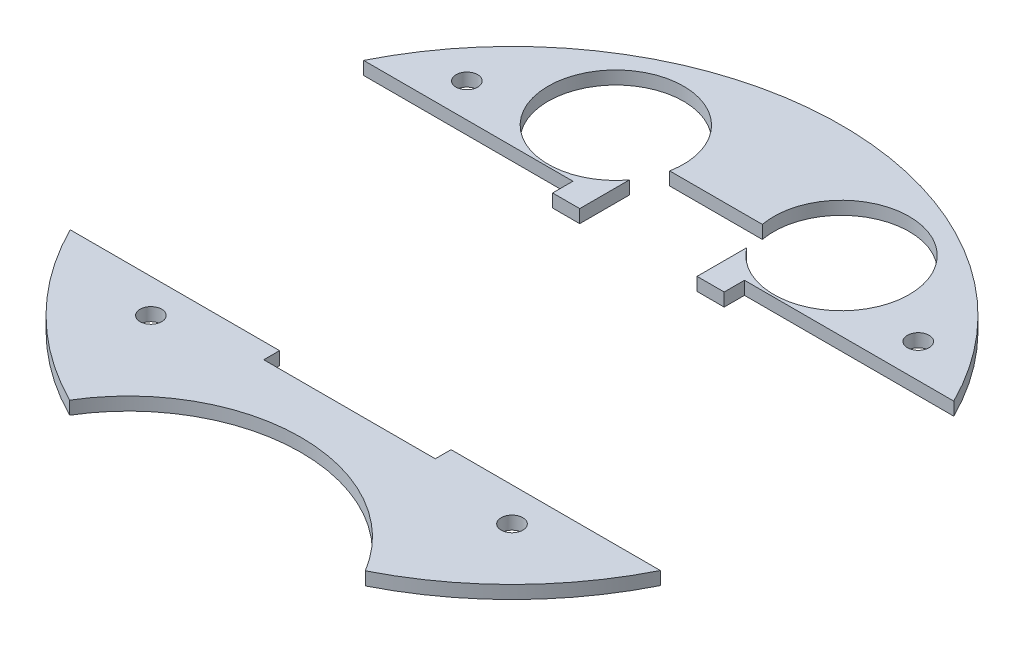
from build123d import *

# Parameters (mm, degrees)
BOSS_EXTRUDE1_DEPTH  = 2.9
SOLENOID_PLACEMENT_W = 38
SOLENOID_PLACEMENT_H = 64
CUT_EXTRUDE1_DEPTH   = 104.278313309
SKETCH3_R            = 12
CUT_EXTRUDE3_DEPTH   = 104.278313309
SKETCH4_R            = 2.4
CUT_EXTRUDE4_DEPTH   = 104.400386846
CUT_EXTRUDE2_DEPTH   = 104.278313309
CUT_EXTRUDE5_DEPTH   = 99.031423533
SKETCH6_R            = 15
CUT_EXTRUDE10_DEPTH  = 99.031423533


with BuildPart() as part:
    # Sketch1 → Boss-Extrude1 (new body)
    with BuildSketch(Plane(origin=(0, 0, 0), x_dir=(1, 0, 0), z_dir=(0, 1, 0))):
        with BuildLine():
            ThreePointArc((32.751135309, -65.240808824), (0, 73), (-32.751135309, -65.240808824))
            ThreePointArc((-32.751135309, -65.240808824), (0, -46.75), (32.751135309, -65.240808824))
        make_face()
    extrude(amount=BOSS_EXTRUDE1_DEPTH)

    # solenoid placement → Cut-Extrude1 (cut, through all)
    with BuildSketch(Plane(origin=(0, 2.9, 0), x_dir=(1, 0, 0), z_dir=(0, 1, 0))):
        with Locations((0, -4)):
            Rectangle(SOLENOID_PLACEMENT_W, SOLENOID_PLACEMENT_H)
    extrude(amount=-CUT_EXTRUDE1_DEPTH, mode=Mode.SUBTRACT)

    # Sketch3 → Cut-Extrude3 (cut, through all)
    with BuildSketch(Plane(origin=(0, 2.9, 0), x_dir=(1, 0, 0), z_dir=(0, 1, 0))):
        with Locations((25, 48)):
            Circle(SKETCH3_R)
        with Locations((-25, 48)):
            Circle(SKETCH3_R)
    extrude(amount=-CUT_EXTRUDE3_DEPTH, mode=Mode.SUBTRACT)

    # Sketch4 → Cut-Extrude4 (cut, through all)
    with BuildSketch(Plane(origin=(0, 5.8, 0), x_dir=(1, 0, 0), z_dir=(0, 1, 0))):
        with Locations((40, -40)):
            Circle(SKETCH4_R)
        with Locations((-40, -40)):
            Circle(SKETCH4_R)
        with Locations((-50, 40)):
            Circle(SKETCH4_R)
        with Locations((50, 40)):
            Circle(SKETCH4_R)
    extrude(amount=-CUT_EXTRUDE4_DEPTH, mode=Mode.SUBTRACT)

    # Sketch2 → Cut-Extrude2 (cut, through all)
    with BuildSketch(Plane(origin=(0, 2.9, 0), x_dir=(1, 0, 0), z_dir=(0, 1, 0))):
        Polygon((-19, 28), (-19, 32.5), (-73, 32.5), (-73, -32.5), (73, -32.5), (73, 32.5), (19, 32.5), (19, 28), align=None)
    extrude(amount=-CUT_EXTRUDE2_DEPTH, mode=Mode.SUBTRACT)


with BuildPart() as cut_extrude2_piece_1:
    # of the separate pieces the step leaves, piece 1, a body of its own (cut_extrude2_pieces)
    add(part.part.solids().sort_by_distance((65.366275709, 0, -32.5))[0])

    # Sketch5 → Cut-Extrude5 (cut, through all)
    with BuildSketch(Plane(origin=(0, 2.9, 0), x_dir=(1, 0, 0), z_dir=(0, 1, 0))):
        with BuildLine():
            Line((-13, 28), (13, 28))
            Line((13, 28), (13, 43.2))
            ThreePointArc((13, 43.2), (12.414213562, 44.614213562), (11, 45.2))
            Line((11, 45.2), (-11, 45.2))
            ThreePointArc((-11, 45.2), (-12.414213562, 44.614213562), (-13, 43.2))
            Line((-13, 43.2), (-13, 28))
        make_face()
    extrude(amount=-CUT_EXTRUDE5_DEPTH, mode=Mode.SUBTRACT)

    # Sketch6 → Cut-Extrude10 (cut, through all)
    with BuildSketch(Plane(origin=(0, 2.9, 0), x_dir=(-1, 0, 0), z_dir=(0, 1, 0))):
        with Locations((-25, -48)):
            Circle(SKETCH6_R)
        with Locations((25, -48)):
            Circle(SKETCH6_R)
    extrude(amount=-CUT_EXTRUDE10_DEPTH, mode=Mode.SUBTRACT)


with BuildPart() as cut_extrude2_piece_2:
    # of the separate pieces the step leaves, piece 2, a body of its own (cut_extrude2_pieces)
    add(part.part.solids().sort_by_distance((-32.751135309, 0, 65.240808824))[0])


solid = Compound([cut_extrude2_piece_1.part, cut_extrude2_piece_2.part])
